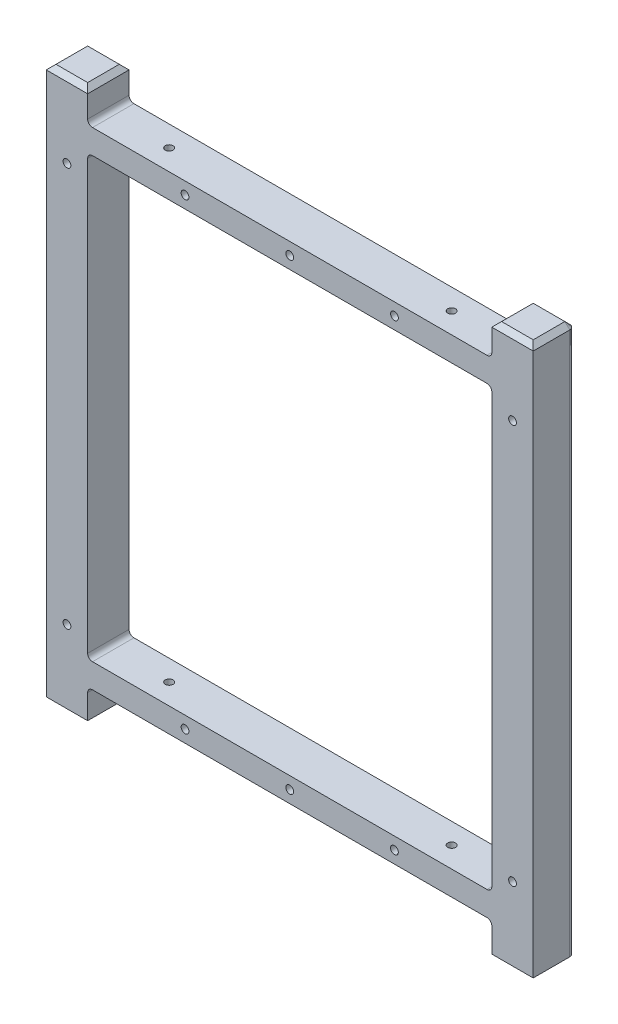
from build123d import *

# Parameters (mm, degrees)
SKETCH1_W           = 100
SKETCH1_H           = 113.5
BOSS_EXTRUDE1_DEPTH = 4.25
CUT_EXTRUDE1_DEPTH  = 77.110528181
M2_HOLE1_C_D        = 1.6
M2_HOLE1_C_DEPTH    = 3
M2_HOLE1_C_TIP      = 0.480688495
M2_HOLE2_D_D        = 1.6
M2_HOLE2_D_DEPTH    = 5
M2_HOLE2_D_TIP      = 0.480688495
M2_HOLE3_E_D        = 1.6
M2_HOLE3_E_DEPTH    = 4
M2_HOLE3_E_TIP      = 0.480688495
M2_HOLE4_F_D        = 1.6
M2_HOLE4_F_DEPTH    = 10
M2_HOLE4_F_TIP      = 0.480688495
M2_HOLE5_G_D        = 1.6
M2_HOLE5_G_DEPTH    = 10
M2_HOLE5_G_TIP      = 0.480688495
M2_HOLE6_H_D        = 1.6
M2_HOLE6_H_DEPTH    = 5
M2_HOLE6_H_TIP      = 0.480688495
FILLET1_R           = 1
CHAMFER1_SIZE       = 1


with BuildPart() as part:
    # Sketch1 → Boss-Extrude1 (new, symmetric)
    with BuildSketch(Plane.XY):
        Rectangle(SKETCH1_W, SKETCH1_H)
    extrude(amount=BOSS_EXTRUDE1_DEPTH, both=True)

    # Sketch4 → Cut-Extrude1 (cut, through all)
    with BuildSketch(Plane.XY.offset(4.25)):
        with BuildLine():
            Line((-40.5, -44.75), (40.5, -44.75))
            ThreePointArc((40.5, -44.75), (41.207106781, -44.457106781), (41.5, -43.75))
            Line((41.5, -43.75), (41.5, 44.25))
            ThreePointArc((41.5, 44.25), (41.207106781, 44.957106781), (40.5, 45.25))
            Line((40.5, 45.25), (-40.5, 45.25))
            ThreePointArc((-40.5, 45.25), (-41.207106781, 44.957106781), (-41.5, 44.25))
            Line((-41.5, 44.25), (-41.5, -43.75))
            ThreePointArc((-41.5, -43.75), (-41.207106781, -44.457106781), (-40.5, -44.75))
        make_face()
        with BuildLine():
            Line((-41.5, 56.75), (41.5, 56.75))
            Line((41.5, 56.75), (41.5, 51.25))
            ThreePointArc((41.5, 51.25), (41.207106781, 50.542893219), (40.5, 50.25))
            Line((40.5, 50.25), (-40.5, 50.25))
            ThreePointArc((-40.5, 50.25), (-41.207106781, 50.542893219), (-41.5, 51.25))
            Line((-41.5, 51.25), (-41.5, 56.75))
        make_face()
        with BuildLine():
            Line((-41.5, -56.75), (41.5, -56.75))
            Line((41.5, -56.75), (41.5, -50.75))
            ThreePointArc((41.5, -50.75), (41.207106781, -50.042893219), (40.5, -49.75))
            Line((40.5, -49.75), (-40.5, -49.75))
            ThreePointArc((-40.5, -49.75), (-41.207106781, -50.042893219), (-41.5, -50.75))
            Line((-41.5, -50.75), (-41.5, -56.75))
        make_face()
    extrude(amount=-CUT_EXTRUDE1_DEPTH, mode=Mode.SUBTRACT)

    # M2 Hole1-C
    with Locations(Plane.XY.offset(4.25)):
        with Locations((-45.75, -40.75), (45.75, -40.75), (-45.75, 41.25), (45.75, 41.25)):
            Hole(M2_HOLE1_C_D / 2, depth=M2_HOLE1_C_DEPTH)
            with Locations((0, 0, -(M2_HOLE1_C_DEPTH + M2_HOLE1_C_TIP / 2))):  # 118° drill point
                Cone(0, M2_HOLE1_C_D / 2, M2_HOLE1_C_TIP, mode=Mode.SUBTRACT)

    # M2 Hole2-D
    with Locations(Plane.XY.offset(4.25)):
        with Locations((-21.5, 47.75), (21.5, 47.75), (-21.5, -47.25), (21.5, -47.25)):
            Hole(M2_HOLE2_D_D / 2, depth=M2_HOLE2_D_DEPTH)
            with Locations((0, 0, -(M2_HOLE2_D_DEPTH + M2_HOLE2_D_TIP / 2))):  # 118° drill point
                Cone(0, M2_HOLE2_D_D / 2, M2_HOLE2_D_TIP, mode=Mode.SUBTRACT)

    # M2 Hole3-E
    with Locations(Plane.XY.offset(4.25)):
        with Locations((0, 47.75), (0, -47.25)):
            Hole(M2_HOLE3_E_D / 2, depth=M2_HOLE3_E_DEPTH)
            with Locations((0, 0, -(M2_HOLE3_E_DEPTH + M2_HOLE3_E_TIP / 2))):  # 118° drill point
                Cone(0, M2_HOLE3_E_D / 2, M2_HOLE3_E_TIP, mode=Mode.SUBTRACT)

    # M2 Hole4-F
    with Locations(Plane(origin=(0, 50.25, 0), x_dir=(1, 0, 0), z_dir=(0, 1, 0))):
        with Locations((-29, 0), (29, 0)):
            Hole(M2_HOLE4_F_D / 2, depth=M2_HOLE4_F_DEPTH)
            with Locations((0, 0, -(M2_HOLE4_F_DEPTH + M2_HOLE4_F_TIP / 2))):  # 118° drill point
                Cone(0, M2_HOLE4_F_D / 2, M2_HOLE4_F_TIP, mode=Mode.SUBTRACT)

    # M2 Hole5-G
    with Locations(Plane(origin=(0, -49.75, 0), x_dir=(-1, 0, 0), z_dir=(0, -1, 0))):
        with Locations((29, 0), (-29, 0)):
            Hole(M2_HOLE5_G_D / 2, depth=M2_HOLE5_G_DEPTH)
            with Locations((0, 0, -(M2_HOLE5_G_DEPTH + M2_HOLE5_G_TIP / 2))):  # 118° drill point
                Cone(0, M2_HOLE5_G_D / 2, M2_HOLE5_G_TIP, mode=Mode.SUBTRACT)

    # M2 Hole6-H
    with Locations(Plane(origin=(0, 0, -4.25), x_dir=(-1, 0, 0), z_dir=(0, 0, -1))):
        with Locations((-35.5, 47.75), (35.5, 47.75), (-35.5, -47.25), (35.5, -47.25)):
            Hole(M2_HOLE6_H_D / 2, depth=M2_HOLE6_H_DEPTH)
            with Locations((0, 0, -(M2_HOLE6_H_DEPTH + M2_HOLE6_H_TIP / 2))):  # 118° drill point
                Cone(0, M2_HOLE6_H_D / 2, M2_HOLE6_H_TIP, mode=Mode.SUBTRACT)

    # Fillet1
    fillet1_edges = [part.edges().sort_by_distance(p)[0] for p in [
        (-50, 0, -4.25),
        (50, 0, -4.25),
    ]]
    fillet(fillet1_edges, radius=FILLET1_R)

    # Chamfer1
    chamfer1_edges = [part.edges().sort_by_distance(p)[0] for p in [
        (-45.75, -56.75, 4.25),
        (45.25, -56.75, -4.25),
        (45.75, -56.75, 4.25),
        (-45.25, -56.75, -4.25),
        (-49.707106781, -56.75, -3.957106781),
        (45.25, 56.75, -4.25),
        (-49.707106781, 56.75, -3.957106781),
        (49.707106781, 56.75, -3.957106781),
        (49.707106781, -56.75, -3.957106781),
        (41.5, -56.75, 0),
        (-41.5, -56.75, 0),
        (-45.25, 56.75, -4.25),
        (-45.75, 56.75, 4.25),
        (-41.5, 56.75, 0),
        (41.5, 56.75, 0),
        (45.75, 56.75, 4.25),
        (50, -56.75, 0.5),
        (-50, -56.75, 0.5),
        (-50, 56.75, 0.5),
        (50, 56.75, 0.5),
    ]]
    chamfer(chamfer1_edges, length=CHAMFER1_SIZE - 0.0001)  # a hair under: the kernel refuses the full size


solid = part.part
